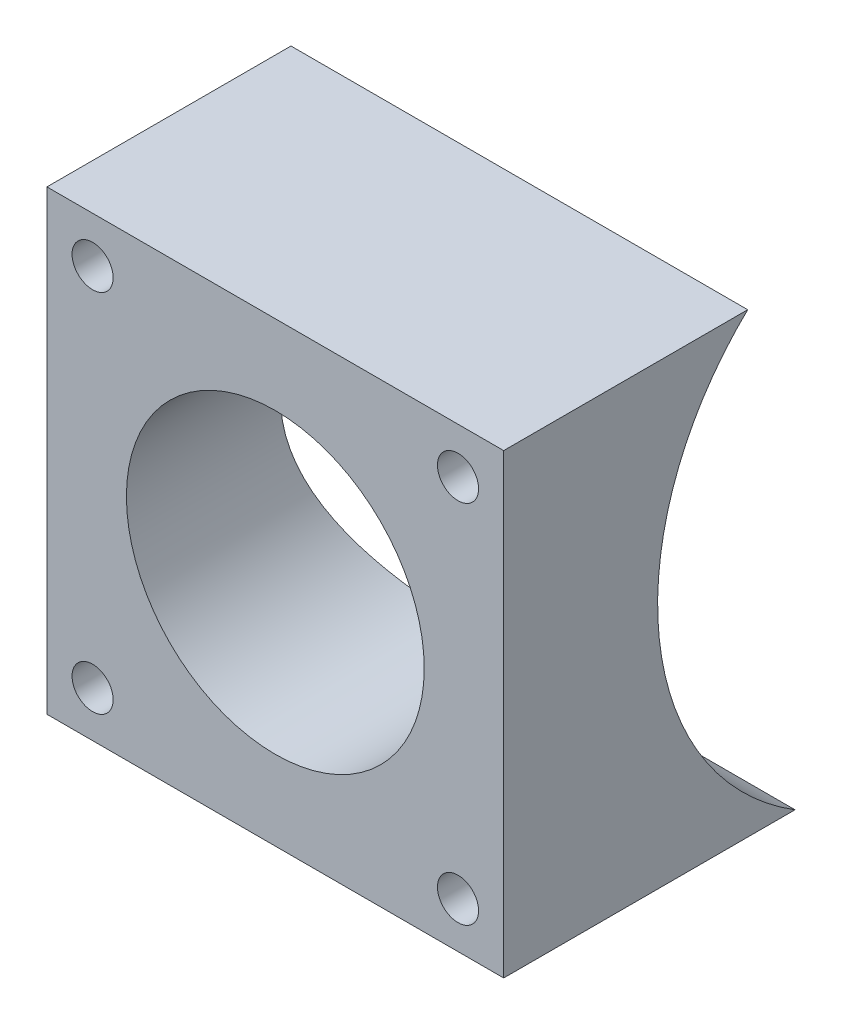
from build123d import *

# Parameters (mm, degrees)
SKETCH1_W               = 50
SKETCH1_H               = 50
SKETCH1_R               = 16.3
SKETCH1_R_2             = 2.25
BOSS_EXTRUDE1_DEPTH     = 48.6
CUT_EXTRUDE1_DEPTH      = 61.958674526
CUT_EXTRUDE1_DEPTH_BACK = 61.958674526
SKETCH2_R               = 31.75


with BuildPart() as part:
    # Sketch1 → Boss-Extrude1 (new body)
    with BuildSketch(Plane.XY):
        with Locations((0, -2)):
            Rectangle(SKETCH1_W, SKETCH1_H)
        with Locations((0, -2)):
            Circle(SKETCH1_R, mode=Mode.SUBTRACT)
        with Locations((-20, 18)):
            Circle(SKETCH1_R_2, mode=Mode.SUBTRACT)
        with Locations((20, 18)):
            Circle(SKETCH1_R_2, mode=Mode.SUBTRACT)
        with Locations((20, -22)):
            Circle(SKETCH1_R_2, mode=Mode.SUBTRACT)
        with Locations((-20, -22)):
            Circle(SKETCH1_R_2, mode=Mode.SUBTRACT)
    extrude(amount=BOSS_EXTRUDE1_DEPTH)

    # Sketch2 → Cut-Extrude1 (cut, two sides: drawn at the far end of the back side and taken through both)
    with BuildSketch(Plane(origin=(0, 0, 0), x_dir=(0, 0, -1), z_dir=(1, 0, 0)).offset(-CUT_EXTRUDE1_DEPTH_BACK)):
        Circle(SKETCH2_R)
    extrude(amount=CUT_EXTRUDE1_DEPTH + CUT_EXTRUDE1_DEPTH_BACK, mode=Mode.SUBTRACT)


solid = part.part
